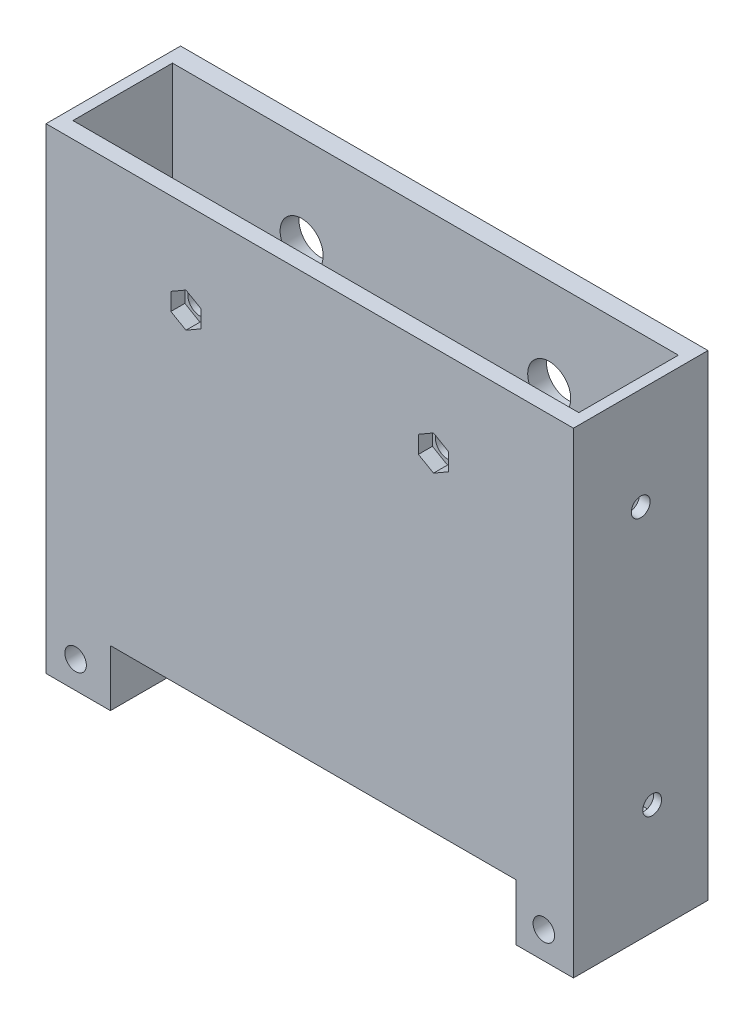
from build123d import *
from build123d.topology import SkipClean

# Parameters (mm, degrees)
SKETCH_2_W           = 98
SKETCH_2_H           = 78
SKETCH_2_R           = 2.25
EXTRUDE_1_DEPTH      = 25
SKETCH_4_W           = 94.182021657
SKETCH_4_H           = 15.686226028
CUT_EXTRUDE_1_DEPTH  = 15
CUT_EXTRUDE_START    = -21.5
SKETCH_3_W           = 94
SKETCH_3_H           = 70
SKETCH_3_R           = 2.25
CUT_EXTRUDE_2_DEPTH  = 18.5
CUT_EXTRUDE_3_REACH  = 74.064
SKETCH_5_R           = 4
EXTRUDE_3_DEPTH      = 22
EXTRUDE_3_DEPTH_BACK = 3
SKETCH_6_W           = 11.966924864
SKETCH_6_H           = 10.472950633
SKETCH_6_R           = 2
SKETCH_6_W_2         = 10.715562549
SKETCH_6_H_2         = 10.536387569
SKETCH_7_R           = 3
CUT_EXTRUDE_4_DEPTH  = 15
SKETCH_9_W           = 94
SKETCH_9_H           = 18.5
CUT_EXTRUDE_5_DEPTH  = 15
EXTRUDE_START        = 2.5
SKETCH_10_R          = 4
SKETCH_10_R_2        = 2.25
EXTRUDE_4_DEPTH      = 2.5
FILLET_1_R           = 10
SKETCH_12_R          = 1.75
CUT_EXTRUDE_6_DEPTH  = 111.498829227
CUT_EXTRUDE_7_DEPTH  = 2.6


with BuildPart() as part:
    # 草图2 → 凸台-拉伸1 (new body)
    with BuildSketch(Plane.XY):
        with Locations((2.33490566, 4.964622642)):
            Rectangle(SKETCH_2_W, SKETCH_2_H)
        with Locations((-20.66509434, 26.964622642)):
            Circle(SKETCH_2_R, mode=Mode.SUBTRACT)
        with Locations((25.33490566, 26.964622642)):
            Circle(SKETCH_2_R, mode=Mode.SUBTRACT)
    extrude(amount=EXTRUDE_1_DEPTH)

    # 草图4 → 切除-拉伸1 (cut)
    with BuildSketch(Plane.XZ.offset(34.035377358)):
        with Locations((2.785262667, 9.306899291)):
            Rectangle(SKETCH_4_W, SKETCH_4_H)
    extrude(amount=-CUT_EXTRUDE_1_DEPTH, mode=Mode.SUBTRACT)

    # 草图3 → 切除-拉伸2 (cut)
    with BuildSketch(Plane.XY.offset(25).offset(CUT_EXTRUDE_START)):
        with Locations((2.33490566, 4.964622642)):
            Rectangle(SKETCH_3_W, SKETCH_3_H)
        with Locations((-20.66509434, 26.964622642)):
            Circle(SKETCH_3_R, mode=Mode.SUBTRACT)
        with Locations((25.33490566, 26.964622642)):
            Circle(SKETCH_3_R, mode=Mode.SUBTRACT)
    extrude(amount=CUT_EXTRUDE_2_DEPTH, mode=Mode.SUBTRACT)

    # 草图5 → 切除-拉伸3 (cut, up to next)
    with BuildSketch(Plane(origin=(0, 0, 0), x_dir=(-1, 0, 0), z_dir=(0, 0, -1)), mode=Mode.PRIVATE) as cut_extrude_3_sk1:
        with Locations((-25.33490566, 26.964622642)):
            Circle(SKETCH_5_R)
    cut_extrude_3_tool1 = extrude(cut_extrude_3_sk1.sketch, amount=-CUT_EXTRUDE_3_REACH, mode=Mode.PRIVATE) & part.part
    # 草图5 → 切除-拉伸3 (cut, up to next)
    with BuildSketch(Plane(origin=(0, 0, 0), x_dir=(-1, 0, 0), z_dir=(0, 0, -1)), mode=Mode.PRIVATE) as cut_extrude_3_sk2:
        with Locations((20.66509434, 26.964622642)):
            Circle(SKETCH_5_R)
    cut_extrude_3_tool2 = extrude(cut_extrude_3_sk2.sketch, amount=-CUT_EXTRUDE_3_REACH, mode=Mode.PRIVATE) & part.part
    add(cut_extrude_3_tool1.solids().sort_by_distance((25.334906, 26.964623, 0))[0], mode=Mode.SUBTRACT)
    add(cut_extrude_3_tool2.solids().sort_by_distance((-20.665094, 26.964623, 0))[0], mode=Mode.SUBTRACT)

    # 草图6 → 凸台-拉伸3 (add, two sides: drawn at the far end of the back side and taken through both)
    # profile 1 of 2: a face of its own
    with BuildSketch(Plane(origin=(0, 0, 22), x_dir=(-1, 0, 0), z_dir=(0, 0, -1)).offset(-EXTRUDE_3_DEPTH_BACK)):
        with Locations((40.681631908, -39.271852675)):
            Rectangle(SKETCH_6_W, SKETCH_6_H)
        with Locations((41.16509434, -39.449232705)):
            Circle(SKETCH_6_R, mode=Mode.SUBTRACT)
    # profile 2 of 2: a face of its own
    with BuildSketch(Plane(origin=(0, 0, 22), x_dir=(-1, 0, 0), z_dir=(0, 0, -1)).offset(-EXTRUDE_3_DEPTH_BACK)):
        with Locations((-45.977124386, -39.240134207)):
            Rectangle(SKETCH_6_W_2, SKETCH_6_H_2)
        with Locations((-45.83490566, -39.449232705)):
            Circle(SKETCH_6_R, mode=Mode.SUBTRACT)
    extrude(amount=EXTRUDE_3_DEPTH + EXTRUDE_3_DEPTH_BACK)

    # 草图7 → 切除-拉伸4 (cut)
    with BuildSketch(Plane(origin=(0, 0, 0), x_dir=(-1, 0, 0), z_dir=(0, 0, -1))):
        with Locations((-45.83490566, -39.449232705)):
            Circle(SKETCH_7_R)
        with Locations((41.16509434, -39.449232705)):
            Circle(SKETCH_7_R)
    extrude(amount=-CUT_EXTRUDE_4_DEPTH, mode=Mode.SUBTRACT)

    # 草图9 → 切除-拉伸5 (cut)
    with BuildSketch(Plane.XZ.offset(-39.964622642)):
        with Locations((2.33490566, 12.75)):
            Rectangle(SKETCH_9_W, SKETCH_9_H)
    extrude(amount=-CUT_EXTRUDE_5_DEPTH, mode=Mode.SUBTRACT)

    # 草图10 → 凸台-拉伸4 (add)
    # profile 1 of 2: a face of its own
    with SkipClean():  # the faces are left unmerged after this step: merging them gives an invalid solid
        with BuildSketch(Plane(origin=(0, 0, 22), x_dir=(-1, 0, 0), z_dir=(0, 0, -1)).offset(EXTRUDE_START)):
            with Locations((-25.33490566, 26.964622642)):
                Circle(SKETCH_10_R)
            with Locations((-25.33490566, 26.964622642)):
                Circle(SKETCH_10_R_2, mode=Mode.SUBTRACT)
        # profile 2 of 2: a face of its own
        with BuildSketch(Plane(origin=(0, 0, 22), x_dir=(-1, 0, 0), z_dir=(0, 0, -1)).offset(EXTRUDE_START)):
            with Locations((20.66509434, 26.964622642)):
                Circle(SKETCH_10_R)
            with Locations((20.66509434, 26.964622642)):
                Circle(SKETCH_10_R_2, mode=Mode.SUBTRACT)
        extrude(amount=-EXTRUDE_4_DEPTH)

    # 圆角1
    # the kernel refuses this fillet: 10 mm, written as the material it adds along each edge
    with BuildSketch(Plane(origin=(25.33490566, 26.964622642, 22), x_dir=(-1, 0, 0), z_dir=(0, -1, 0))) as fillet_1_piece_1:
        with BuildLine():
            CenterArc((10.614378278, 10), FILLET_1_R, 228.590377891, 41.409622109)
            Line((4, 2.5), (3.867712434, 2.35))
            ThreePointArc((3.867712434, 2.35), (3.8, 1.25), (3.8, 0))
            Line((3.8, 0), (4, -0.2))
            Line((4, -0.2), (10.614378278, -0.2))
            Line((10.614378278, -0.2), (10.614378278, 0))
        make_face()
    revolve(axis=Axis((25.33490566, 26.964622642, 22), (0, 0, -1)))
    with BuildSketch(Plane(origin=(-20.66509434, 26.964622642, 22), x_dir=(-1, 0, 0), z_dir=(0, -1, 0))) as fillet_1_piece_2:
        with BuildLine():
            CenterArc((10.614378278, 10), FILLET_1_R, 228.590377891, 41.409622109)
            Line((4, 2.5), (3.867712434, 2.35))
            ThreePointArc((3.867712434, 2.35), (3.8, 1.25), (3.8, 0))
            Line((3.8, 0), (4, -0.2))
            Line((4, -0.2), (10.614378278, -0.2))
            Line((10.614378278, -0.2), (10.614378278, 0))
        make_face()
    revolve(axis=Axis((-20.66509434, 26.964622642, 22), (0, 0, -1)))

    # 草图12 → 切除-拉伸6 (cut, through all)
    with BuildSketch(Plane.ZY.offset(46.66509434)):
        with Locations((10.372747463, -23.946592615)):
            Circle(SKETCH_12_R)
        with Locations((12.5, 25.053407385)):
            Circle(SKETCH_12_R)
    extrude(amount=-CUT_EXTRUDE_6_DEPTH, mode=Mode.SUBTRACT)

    # 草图13 → 切除-拉伸7 (cut)
    with BuildSketch(Plane.XY.offset(25)):
        Polygon((-20.66509434, 30.197784149), (-23.46509434, 28.581203395), (-23.46509434, 25.348041888), (-20.66509434, 23.731461134), (-17.86509434, 25.348041888), (-17.86509434, 28.581203395), align=None)
        Polygon((25.33490566, 30.197784149), (22.53490566, 28.581203395), (22.53490566, 25.348041888), (25.33490566, 23.731461134), (28.13490566, 25.348041888), (28.13490566, 28.581203395), align=None)
    extrude(amount=-CUT_EXTRUDE_7_DEPTH, mode=Mode.SUBTRACT)


solid = part.part
